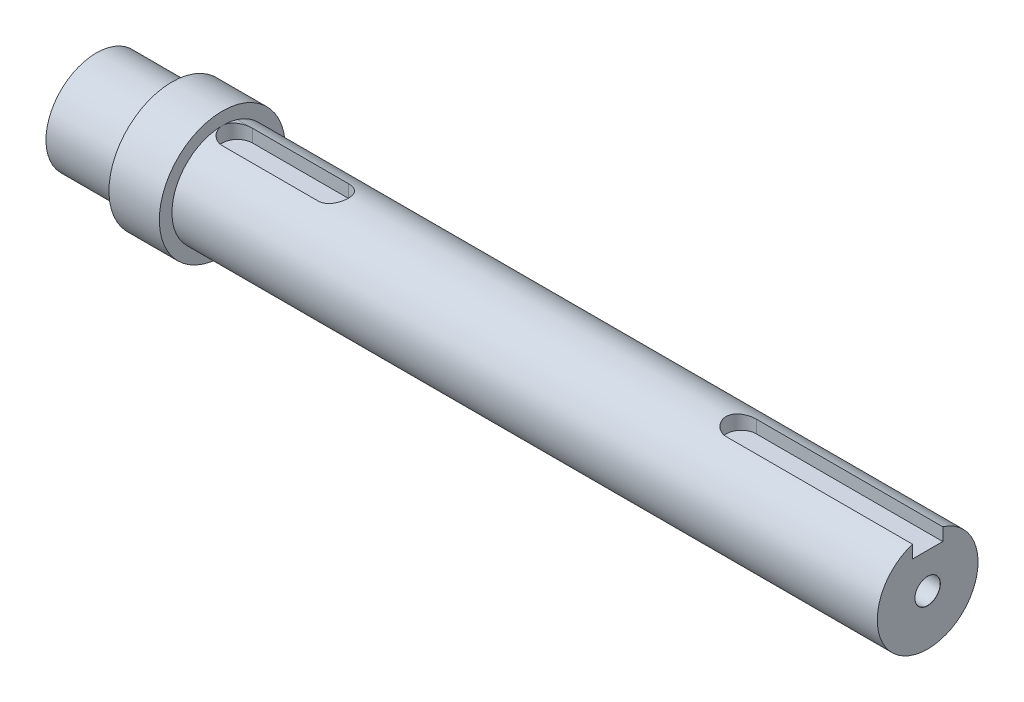
from build123d import *

# Parameters (mm, degrees)
REVOLVE_THIN1_OUTLINE_R                   = 10
REVOLVE_THIN1_DEPTH                       = 165
REVOLVE_THIN1_START                       = 15
REVOLVE_THIN1_2_OUTLINE_R                 = 12.5
REVOLVE_THIN1_2_OUTLINE_R_2               = 10
REVOLVE_THIN1_2_DEPTH                     = 10
F_5_0MM_DOWEL_HOLE1_D                     = 5
F_5_0MM_DOWEL_HOLE1_DEPTH                 = 10
F_5_0MM_DOWEL_HOLE1_CSINK_D               = 5.05
F_5_0MM_DOWEL_HOLE1_CSINK_ANGLE           = 90
F_5_0MM_DOWEL_HOLE1_TIP                   = 1.502151548
F_5_0MM_DOWEL_HOLE1_ON_FACE_2_D           = 5
F_5_0MM_DOWEL_HOLE1_ON_FACE_2_DEPTH       = 10
F_5_0MM_DOWEL_HOLE1_ON_FACE_2_CSINK_D     = 5.05
F_5_0MM_DOWEL_HOLE1_ON_FACE_2_CSINK_ANGLE = 90
F_5_0MM_DOWEL_HOLE1_ON_FACE_2_TIP         = 1.502151548
CUT_EXTRUDE1_DEPTH                        = 3


# Read off the part's stored shape, not the designer's step: Revolve-Thin1
with BuildPart() as part:
    # Revolve-Thin1 outline → Revolve-Thin1 (new body)
    with BuildSketch(Plane.YZ):
        Circle(REVOLVE_THIN1_OUTLINE_R)
    extrude(amount=REVOLVE_THIN1_DEPTH)

    # Revolve-Thin1 2 outline → Revolve-Thin1 2 (add)
    with BuildSketch(Plane.YZ.offset(REVOLVE_THIN1_START)):
        Circle(REVOLVE_THIN1_2_OUTLINE_R)
        Circle(REVOLVE_THIN1_2_OUTLINE_R_2, mode=Mode.SUBTRACT)
    extrude(amount=REVOLVE_THIN1_2_DEPTH)

    # Ø5.0mm Dowel Hole1
    with Locations(Plane(origin=(0, 0, 0), x_dir=(0, -1, 0), z_dir=(-1, 0, 0))):
        with Locations((0, 0)):
            CounterSinkHole(F_5_0MM_DOWEL_HOLE1_D / 2, F_5_0MM_DOWEL_HOLE1_CSINK_D / 2, depth=F_5_0MM_DOWEL_HOLE1_DEPTH, counter_sink_angle=F_5_0MM_DOWEL_HOLE1_CSINK_ANGLE)
            with Locations((0, 0, -(F_5_0MM_DOWEL_HOLE1_DEPTH + F_5_0MM_DOWEL_HOLE1_TIP / 2))):  # 118° drill point
                Cone(0, F_5_0MM_DOWEL_HOLE1_D / 2, F_5_0MM_DOWEL_HOLE1_TIP, mode=Mode.SUBTRACT)

    # Ø5.0mm Dowel Hole1 on face 2
    with Locations(Plane(origin=(165, 0, 0), x_dir=(0, 0, 1), z_dir=(1, 0, 0))):
        with Locations((0, 0)):
            CounterSinkHole(F_5_0MM_DOWEL_HOLE1_ON_FACE_2_D / 2, F_5_0MM_DOWEL_HOLE1_ON_FACE_2_CSINK_D / 2, depth=F_5_0MM_DOWEL_HOLE1_ON_FACE_2_DEPTH, counter_sink_angle=F_5_0MM_DOWEL_HOLE1_ON_FACE_2_CSINK_ANGLE)
            with Locations((0, 0, -(F_5_0MM_DOWEL_HOLE1_ON_FACE_2_DEPTH + F_5_0MM_DOWEL_HOLE1_ON_FACE_2_TIP / 2))):  # 118° drill point
                Cone(0, F_5_0MM_DOWEL_HOLE1_ON_FACE_2_D / 2, F_5_0MM_DOWEL_HOLE1_ON_FACE_2_TIP, mode=Mode.SUBTRACT)

    # Sketch3 → Cut-Extrude1 (cut)
    with BuildSketch(Plane(origin=(0, 10, 0), x_dir=(1, 0, 0), z_dir=(0, 1, 0))):
        with BuildLine():
            Line((28, 3), (47, 3))
            ThreePointArc((47, 3), (50, 0), (47, -3))
            Line((47, -3), (28, -3))
            ThreePointArc((28, -3), (25, 0), (28, 3))
        make_face()
        with BuildLine():
            Line((165, -3), (128, -3))
            ThreePointArc((128, -3), (125, 0), (128, 3))
            Line((128, 3), (165, 3))
            ThreePointArc((165, 3), (168, 0), (165, -3))
        make_face()
    extrude(amount=-CUT_EXTRUDE1_DEPTH, mode=Mode.SUBTRACT)


solid = part.part
